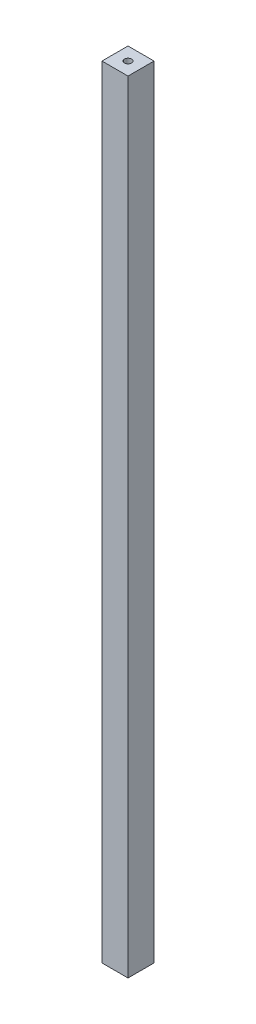
from build123d import *

# Parameters (mm, degrees)
SKETCH1_W             = 10
SKETCH1_H             = 10
BOSS_EXTRUDE1_DEPTH   = 300
F_6_32_TAPPED_HOLE1_D = 2.7051


with BuildPart() as part:
    # Sketch1 → Boss-Extrude1 (new body)
    with BuildSketch(Plane(origin=(0, 0, 0), x_dir=(1, 0, 0), z_dir=(0, 1, 0))):
        with Locations((5, 5)):
            Rectangle(SKETCH1_W, SKETCH1_H)
    extrude(amount=BOSS_EXTRUDE1_DEPTH)

    # #6-32 Tapped Hole1 (through all)
    with Locations(Plane(origin=(0, 300, 0), x_dir=(1, 0, 0), z_dir=(0, 1, 0))):
        with Locations((5, 5)):
            Hole(F_6_32_TAPPED_HOLE1_D / 2)


solid = part.part
